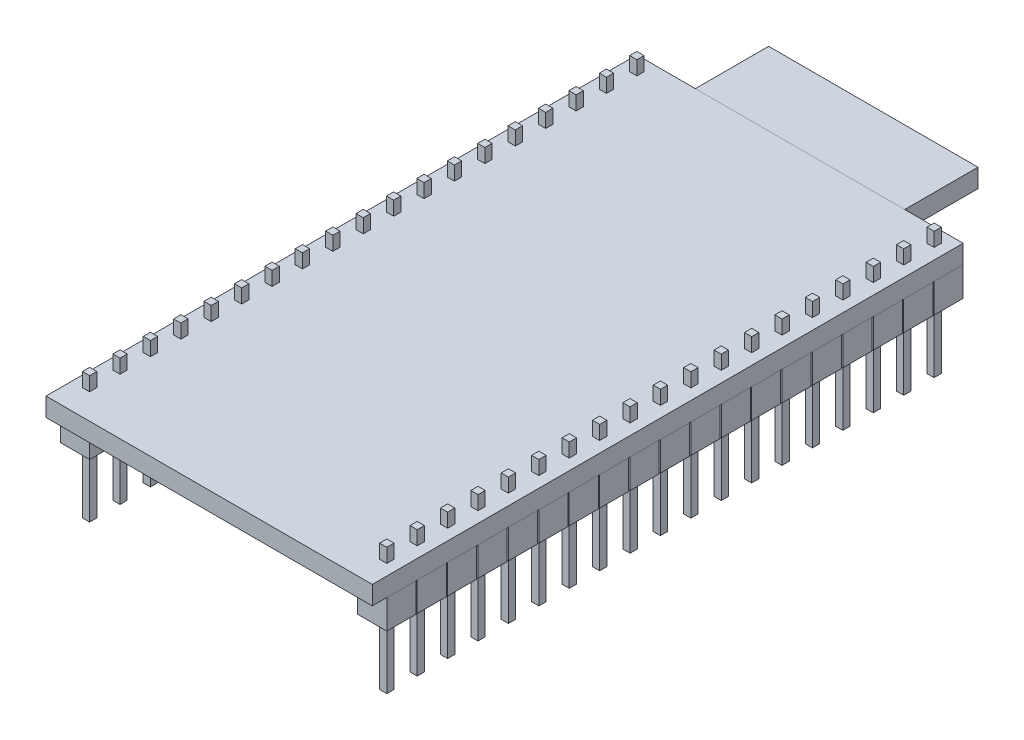
from build123d import *

# Parameters (mm, degrees)
SKETCH1_W                = 28.05
SKETCH1_H                = 50.8
BOSS_EXTRUDE1_DEPTH      = 1.6
SKETCH2_W                = 2.5
SKETCH2_H                = 2.5
BOSS_EXTRUDE2_DEPTH      = 2.5
BOSS_EXTRUDE3_DEPTH      = 5.6
BOSS_EXTRUDE3_DEPTH_BACK = 5.3
SKETCH3_W                = 0.62
SKETCH3_H                = 0.62
LPATTERN1_START          = -2.5
LPATTERN1_OUTLINE_W      = 2.5
LPATTERN1_OUTLINE_H      = 2.5
LPATTERN1_DEPTH          = 2.5
LPATTERN1_START_2        = -8.1
LPATTERN1_2_OUTLINE_W    = 0.62
LPATTERN1_2_OUTLINE_H    = 0.62
LPATTERN1_2_DEPTH        = 10.9
SKETCH4_W                = 18
SKETCH4_H                = 6.3
BOSS_EXTRUDE4_DEPTH      = 1.6


# Read off the part's stored shape, not the designer's step: LPattern1
with BuildPart() as part:
    # Sketch1 → Boss-Extrude1 (new body)
    with BuildSketch(Plane(origin=(0, 0, 0), x_dir=(1, 0, 0), z_dir=(0, 1, 0))):
        Rectangle(SKETCH1_W, SKETCH1_H)
    extrude(amount=BOSS_EXTRUDE1_DEPTH)


with BuildPart() as body_2:
    # Sketch2 → Boss-Extrude2 (new body)
    with BuildSketch(Plane.XZ):
        with Locations((-12.775, -24.15)):
            Rectangle(SKETCH2_W, SKETCH2_H)
    extrude(amount=BOSS_EXTRUDE2_DEPTH)


with BuildPart() as body_3:
    # Sketch3 → Boss-Extrude3 (new, two sides: drawn at the far end of the back side and taken through both)
    with BuildSketch(Plane.XZ.offset(2.5).offset(-BOSS_EXTRUDE3_DEPTH_BACK)):
        with Locations((-12.775, -24.15)):
            Rectangle(SKETCH3_W, SKETCH3_H)
    extrude(amount=BOSS_EXTRUDE3_DEPTH + BOSS_EXTRUDE3_DEPTH_BACK)


with BuildPart() as body_4:
    # LPattern1 outline → LPattern1 (new body)
    with BuildSketch(Plane(origin=(0, 0, 0), x_dir=(1, 0, 0), z_dir=(0, 1, 0)).offset(LPATTERN1_START)):
        with Locations((12.775, -22.9)):
            Rectangle(LPATTERN1_OUTLINE_W, LPATTERN1_OUTLINE_H)
        with Locations((-12.775, -22.9)):
            Rectangle(LPATTERN1_OUTLINE_W, LPATTERN1_OUTLINE_H)
        with Locations((12.775, -20.286111111)):
            Rectangle(LPATTERN1_OUTLINE_W, LPATTERN1_OUTLINE_H)
        with Locations((12.775, -17.672222222)):
            Rectangle(LPATTERN1_OUTLINE_W, LPATTERN1_OUTLINE_H)
        with Locations((12.775, -15.058333333)):
            Rectangle(LPATTERN1_OUTLINE_W, LPATTERN1_OUTLINE_H)
        with Locations((12.775, -12.444444444)):
            Rectangle(LPATTERN1_OUTLINE_W, LPATTERN1_OUTLINE_H)
        with Locations((12.775, -9.830555556)):
            Rectangle(LPATTERN1_OUTLINE_W, LPATTERN1_OUTLINE_H)
        with Locations((12.775, -7.216666667)):
            Rectangle(LPATTERN1_OUTLINE_W, LPATTERN1_OUTLINE_H)
        with Locations((12.775, -4.602777778)):
            Rectangle(LPATTERN1_OUTLINE_W, LPATTERN1_OUTLINE_H)
        with Locations((12.775, -1.988888889)):
            Rectangle(LPATTERN1_OUTLINE_W, LPATTERN1_OUTLINE_H)
        with Locations((12.775, 0.625)):
            Rectangle(LPATTERN1_OUTLINE_W, LPATTERN1_OUTLINE_H)
        with Locations((12.775, 3.238888889)):
            Rectangle(LPATTERN1_OUTLINE_W, LPATTERN1_OUTLINE_H)
        with Locations((12.775, 5.852777778)):
            Rectangle(LPATTERN1_OUTLINE_W, LPATTERN1_OUTLINE_H)
        with Locations((12.775, 8.466666667)):
            Rectangle(LPATTERN1_OUTLINE_W, LPATTERN1_OUTLINE_H)
        with Locations((12.775, 11.080555556)):
            Rectangle(LPATTERN1_OUTLINE_W, LPATTERN1_OUTLINE_H)
        with Locations((12.775, 13.694444444)):
            Rectangle(LPATTERN1_OUTLINE_W, LPATTERN1_OUTLINE_H)
        with Locations((12.775, 16.308333333)):
            Rectangle(LPATTERN1_OUTLINE_W, LPATTERN1_OUTLINE_H)
        with Locations((12.775, 18.922222222)):
            Rectangle(LPATTERN1_OUTLINE_W, LPATTERN1_OUTLINE_H)
        with Locations((12.775, 21.536111111)):
            Rectangle(LPATTERN1_OUTLINE_W, LPATTERN1_OUTLINE_H)
        with Locations((12.775, 24.15)):
            Rectangle(LPATTERN1_OUTLINE_W, LPATTERN1_OUTLINE_H)
        with Locations((-12.775, -20.286111111)):
            Rectangle(LPATTERN1_OUTLINE_W, LPATTERN1_OUTLINE_H)
        with Locations((-12.775, -17.672222222)):
            Rectangle(LPATTERN1_OUTLINE_W, LPATTERN1_OUTLINE_H)
        with Locations((-12.775, -15.058333333)):
            Rectangle(LPATTERN1_OUTLINE_W, LPATTERN1_OUTLINE_H)
        with Locations((-12.775, -12.444444444)):
            Rectangle(LPATTERN1_OUTLINE_W, LPATTERN1_OUTLINE_H)
        with Locations((-12.775, -9.830555556)):
            Rectangle(LPATTERN1_OUTLINE_W, LPATTERN1_OUTLINE_H)
        with Locations((-12.775, -7.216666667)):
            Rectangle(LPATTERN1_OUTLINE_W, LPATTERN1_OUTLINE_H)
        with Locations((-12.775, -4.602777778)):
            Rectangle(LPATTERN1_OUTLINE_W, LPATTERN1_OUTLINE_H)
        with Locations((-12.775, -1.988888889)):
            Rectangle(LPATTERN1_OUTLINE_W, LPATTERN1_OUTLINE_H)
        with Locations((-12.775, 0.625)):
            Rectangle(LPATTERN1_OUTLINE_W, LPATTERN1_OUTLINE_H)
        with Locations((-12.775, 3.238888889)):
            Rectangle(LPATTERN1_OUTLINE_W, LPATTERN1_OUTLINE_H)
        with Locations((-12.775, 5.852777778)):
            Rectangle(LPATTERN1_OUTLINE_W, LPATTERN1_OUTLINE_H)
        with Locations((-12.775, 8.466666667)):
            Rectangle(LPATTERN1_OUTLINE_W, LPATTERN1_OUTLINE_H)
        with Locations((-12.775, 11.080555556)):
            Rectangle(LPATTERN1_OUTLINE_W, LPATTERN1_OUTLINE_H)
        with Locations((-12.775, 13.694444444)):
            Rectangle(LPATTERN1_OUTLINE_W, LPATTERN1_OUTLINE_H)
        with Locations((-12.775, 16.308333333)):
            Rectangle(LPATTERN1_OUTLINE_W, LPATTERN1_OUTLINE_H)
        with Locations((-12.775, 18.922222222)):
            Rectangle(LPATTERN1_OUTLINE_W, LPATTERN1_OUTLINE_H)
        with Locations((-12.775, 21.536111111)):
            Rectangle(LPATTERN1_OUTLINE_W, LPATTERN1_OUTLINE_H)
    extrude(amount=LPATTERN1_DEPTH)


with BuildPart() as body_5:
    # LPattern1 2 outline → LPattern1 2 (new body)
    with BuildSketch(Plane(origin=(0, 0, 0), x_dir=(1, 0, 0), z_dir=(0, 1, 0)).offset(LPATTERN1_START_2)):
        with Locations((12.775, -22.9)):
            Rectangle(LPATTERN1_2_OUTLINE_W, LPATTERN1_2_OUTLINE_H)
        with Locations((-12.775, -22.9)):
            Rectangle(LPATTERN1_2_OUTLINE_W, LPATTERN1_2_OUTLINE_H)
        with Locations((12.775, -20.286111111)):
            Rectangle(LPATTERN1_2_OUTLINE_W, LPATTERN1_2_OUTLINE_H)
        with Locations((12.775, -17.672222222)):
            Rectangle(LPATTERN1_2_OUTLINE_W, LPATTERN1_2_OUTLINE_H)
        with Locations((12.775, -15.058333333)):
            Rectangle(LPATTERN1_2_OUTLINE_W, LPATTERN1_2_OUTLINE_H)
        with Locations((12.775, -12.444444444)):
            Rectangle(LPATTERN1_2_OUTLINE_W, LPATTERN1_2_OUTLINE_H)
        with Locations((12.775, -9.830555556)):
            Rectangle(LPATTERN1_2_OUTLINE_W, LPATTERN1_2_OUTLINE_H)
        with Locations((12.775, -7.216666667)):
            Rectangle(LPATTERN1_2_OUTLINE_W, LPATTERN1_2_OUTLINE_H)
        with Locations((12.775, -4.602777778)):
            Rectangle(LPATTERN1_2_OUTLINE_W, LPATTERN1_2_OUTLINE_H)
        with Locations((12.775, -1.988888889)):
            Rectangle(LPATTERN1_2_OUTLINE_W, LPATTERN1_2_OUTLINE_H)
        with Locations((12.775, 0.625)):
            Rectangle(LPATTERN1_2_OUTLINE_W, LPATTERN1_2_OUTLINE_H)
        with Locations((12.775, 3.238888889)):
            Rectangle(LPATTERN1_2_OUTLINE_W, LPATTERN1_2_OUTLINE_H)
        with Locations((12.775, 5.852777778)):
            Rectangle(LPATTERN1_2_OUTLINE_W, LPATTERN1_2_OUTLINE_H)
        with Locations((12.775, 8.466666667)):
            Rectangle(LPATTERN1_2_OUTLINE_W, LPATTERN1_2_OUTLINE_H)
        with Locations((12.775, 11.080555556)):
            Rectangle(LPATTERN1_2_OUTLINE_W, LPATTERN1_2_OUTLINE_H)
        with Locations((12.775, 13.694444444)):
            Rectangle(LPATTERN1_2_OUTLINE_W, LPATTERN1_2_OUTLINE_H)
        with Locations((12.775, 16.308333333)):
            Rectangle(LPATTERN1_2_OUTLINE_W, LPATTERN1_2_OUTLINE_H)
        with Locations((12.775, 18.922222222)):
            Rectangle(LPATTERN1_2_OUTLINE_W, LPATTERN1_2_OUTLINE_H)
        with Locations((12.775, 21.536111111)):
            Rectangle(LPATTERN1_2_OUTLINE_W, LPATTERN1_2_OUTLINE_H)
        with Locations((12.775, 24.15)):
            Rectangle(LPATTERN1_2_OUTLINE_W, LPATTERN1_2_OUTLINE_H)
        with Locations((-12.775, -20.286111111)):
            Rectangle(LPATTERN1_2_OUTLINE_W, LPATTERN1_2_OUTLINE_H)
        with Locations((-12.775, -17.672222222)):
            Rectangle(LPATTERN1_2_OUTLINE_W, LPATTERN1_2_OUTLINE_H)
        with Locations((-12.775, -15.058333333)):
            Rectangle(LPATTERN1_2_OUTLINE_W, LPATTERN1_2_OUTLINE_H)
        with Locations((-12.775, -12.444444444)):
            Rectangle(LPATTERN1_2_OUTLINE_W, LPATTERN1_2_OUTLINE_H)
        with Locations((-12.775, -9.830555556)):
            Rectangle(LPATTERN1_2_OUTLINE_W, LPATTERN1_2_OUTLINE_H)
        with Locations((-12.775, -7.216666667)):
            Rectangle(LPATTERN1_2_OUTLINE_W, LPATTERN1_2_OUTLINE_H)
        with Locations((-12.775, -4.602777778)):
            Rectangle(LPATTERN1_2_OUTLINE_W, LPATTERN1_2_OUTLINE_H)
        with Locations((-12.775, -1.988888889)):
            Rectangle(LPATTERN1_2_OUTLINE_W, LPATTERN1_2_OUTLINE_H)
        with Locations((-12.775, 0.625)):
            Rectangle(LPATTERN1_2_OUTLINE_W, LPATTERN1_2_OUTLINE_H)
        with Locations((-12.775, 3.238888889)):
            Rectangle(LPATTERN1_2_OUTLINE_W, LPATTERN1_2_OUTLINE_H)
        with Locations((-12.775, 5.852777778)):
            Rectangle(LPATTERN1_2_OUTLINE_W, LPATTERN1_2_OUTLINE_H)
        with Locations((-12.775, 8.466666667)):
            Rectangle(LPATTERN1_2_OUTLINE_W, LPATTERN1_2_OUTLINE_H)
        with Locations((-12.775, 11.080555556)):
            Rectangle(LPATTERN1_2_OUTLINE_W, LPATTERN1_2_OUTLINE_H)
        with Locations((-12.775, 13.694444444)):
            Rectangle(LPATTERN1_2_OUTLINE_W, LPATTERN1_2_OUTLINE_H)
        with Locations((-12.775, 16.308333333)):
            Rectangle(LPATTERN1_2_OUTLINE_W, LPATTERN1_2_OUTLINE_H)
        with Locations((-12.775, 18.922222222)):
            Rectangle(LPATTERN1_2_OUTLINE_W, LPATTERN1_2_OUTLINE_H)
        with Locations((-12.775, 21.536111111)):
            Rectangle(LPATTERN1_2_OUTLINE_W, LPATTERN1_2_OUTLINE_H)
    extrude(amount=LPATTERN1_2_DEPTH)


with BuildPart() as body_6:
    # Sketch4 → Boss-Extrude4 (new body)
    with BuildSketch(Plane.XZ):
        with Locations((0, -28.55)):
            Rectangle(SKETCH4_W, SKETCH4_H)
    extrude(amount=-BOSS_EXTRUDE4_DEPTH)


solid = Compound([part.part, body_2.part, body_3.part, body_4.part, body_5.part, body_6.part])
